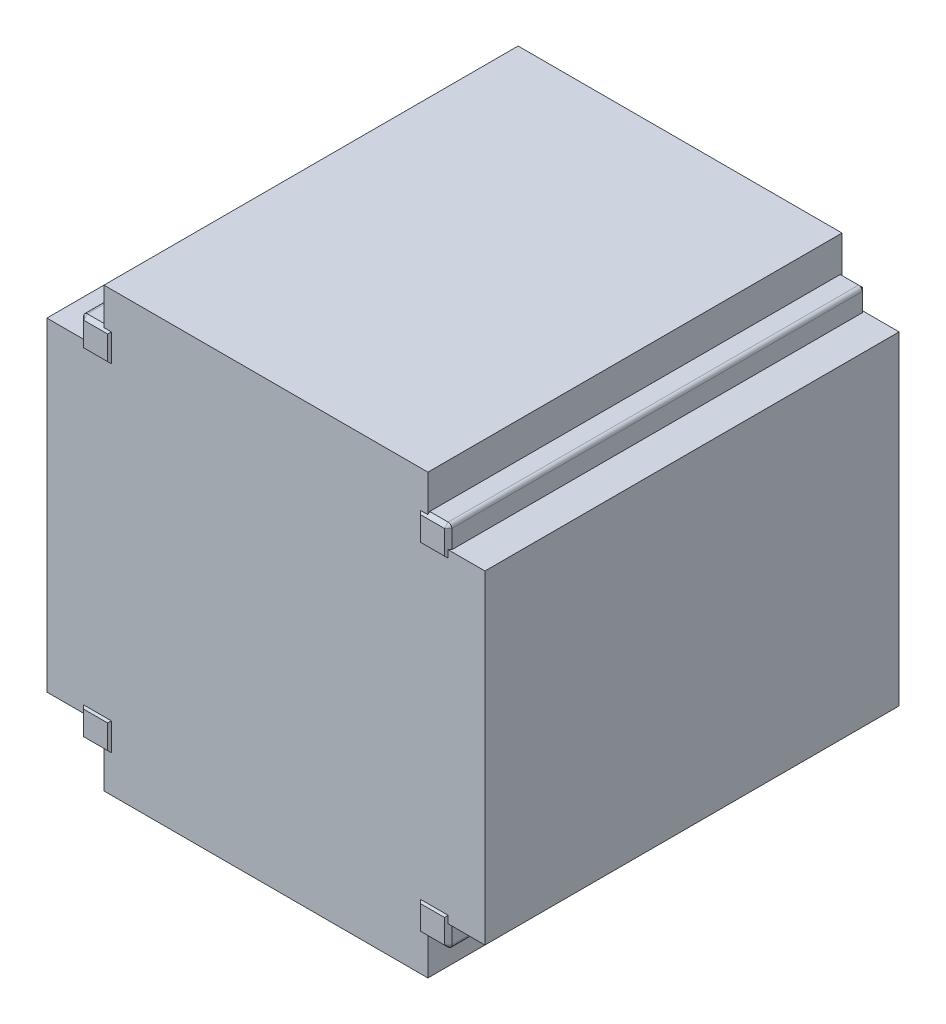
from build123d import *

# Parameters (mm, degrees)
BOSS_EXTRUDE1_DEPTH        = 56.75
BOSS_EXTRUDE1_DEPTH_BACK   = 56.75
SKETCH1_W                  = 8.5
SKETCH1_H                  = 8.5
BOSS_EXTRUDE1_2_DEPTH      = 56.75
BOSS_EXTRUDE1_2_DEPTH_BACK = 56.75
BOSS_EXTRUDE1_3_DEPTH      = 56.75
BOSS_EXTRUDE1_3_DEPTH_BACK = 56.75
BOSS_EXTRUDE1_4_DEPTH      = 56.75
BOSS_EXTRUDE1_4_DEPTH_BACK = 56.75
BOSS_EXTRUDE2_DEPTH        = 56.25
BOSS_EXTRUDE2_DEPTH_BACK   = 56.25
FILLET1_R                  = 1
CHAMFER2_SIZE              = 1


with BuildPart() as part:
    # Sketch1 → Boss-Extrude1 (new, two sides: drawn at the far end of the back side and taken through both)
    with BuildSketch(Plane.XY.offset(-BOSS_EXTRUDE1_DEPTH_BACK)):
        with Locations((-45.75, 45.75)):
            Rectangle(SKETCH1_W, SKETCH1_H)
    extrude(amount=BOSS_EXTRUDE1_DEPTH + BOSS_EXTRUDE1_DEPTH_BACK)



with BuildPart() as body_2:
    # Sketch1 → Boss-Extrude1 2 (new, two sides: drawn at the far end of the back side and taken through both)
    with BuildSketch(Plane.XY.offset(-BOSS_EXTRUDE1_2_DEPTH_BACK)):
        with Locations((45.75, 45.75)):
            Rectangle(SKETCH1_W, SKETCH1_H)
    extrude(amount=BOSS_EXTRUDE1_2_DEPTH + BOSS_EXTRUDE1_2_DEPTH_BACK)


with BuildPart() as body_3:
    # Sketch1 → Boss-Extrude1 3 (new, two sides: drawn at the far end of the back side and taken through both)
    with BuildSketch(Plane.XY.offset(-BOSS_EXTRUDE1_3_DEPTH_BACK)):
        with Locations((45.75, -45.75)):
            Rectangle(SKETCH1_W, SKETCH1_H)
    extrude(amount=BOSS_EXTRUDE1_3_DEPTH + BOSS_EXTRUDE1_3_DEPTH_BACK)


with BuildPart() as body_4:
    # Sketch1 → Boss-Extrude1 4 (new, two sides: drawn at the far end of the back side and taken through both)
    with BuildSketch(Plane.XY.offset(-BOSS_EXTRUDE1_4_DEPTH_BACK)):
        with Locations((-45.75, -45.75)):
            Rectangle(SKETCH1_W, SKETCH1_H)
    extrude(amount=BOSS_EXTRUDE1_4_DEPTH + BOSS_EXTRUDE1_4_DEPTH_BACK)


with BuildPart() as part_1:
    add(part.part)

    add(body_2.part)  # Boss-Extrude2 merges body 2

    add(body_3.part)  # Boss-Extrude2 merges body 3

    add(body_4.part)  # Boss-Extrude2 merges body 4
    # Sketch2 → Boss-Extrude2 (add, two sides: drawn at the far end of the back side and taken through both)
    with BuildSketch(Plane.XY.offset(-BOSS_EXTRUDE2_DEPTH_BACK)):
        Polygon((-44, 50), (-44, 59.5), (44, 59.5), (44, 50), (50, 50), (50, 44), (59.5, 44), (59.5, -44), (50, -44), (50, -50), (44, -50), (44, -59.5), (-44, -59.5), (-44, -50), (-50, -50), (-50, -44), (-59.5, -44), (-59.5, 44), (-50, 44), (-50, 50), align=None)
    extrude(amount=BOSS_EXTRUDE2_DEPTH + BOSS_EXTRUDE2_DEPTH_BACK)

    # Fillet1
    fillet1_edges = [part_1.edges().sort_by_distance(p)[0] for p in [
        (50, -50, 0),
        (-50, -50, 0),
        (-50, 50, 0),
        (50, 50, 0),
    ]]
    fillet(fillet1_edges, radius=FILLET1_R)

    # Chamfer2
    chamfer2_edges = [part_1.edges().sort_by_distance(p)[0] for p in [
        (45.25, -50, 56.75),
        (50, -45.25, 56.75),
        (49.707106781, -49.707106781, 56.75),
    ]]
    chamfer(chamfer2_edges, length=CHAMFER2_SIZE)
    chamfer2_2_edges = [part_1.edges().sort_by_distance(p)[0] for p in [
        (45.25, -50, -56.75),
        (50, -45.25, -56.75),
        (49.707106781, -49.707106781, -56.75),
    ]]
    chamfer(chamfer2_2_edges, length=CHAMFER2_SIZE)
    chamfer2_3_edges = [part_1.edges().sort_by_distance(p)[0] for p in [
        (50, 45.25, 56.75),
        (45.25, 50, 56.75),
        (49.707106781, 49.707106781, 56.75),
    ]]
    chamfer(chamfer2_3_edges, length=CHAMFER2_SIZE)
    chamfer2_4_edges = [part_1.edges().sort_by_distance(p)[0] for p in [
        (50, 45.25, -56.75),
        (45.25, 50, -56.75),
        (49.707106781, 49.707106781, -56.75),
    ]]
    chamfer(chamfer2_4_edges, length=CHAMFER2_SIZE)
    chamfer2_5_edges = [part_1.edges().sort_by_distance(p)[0] for p in [
        (-45.25, 50, 56.75),
        (-49.707106781, 49.707106781, 56.75),
        (-50, 45.25, 56.75),
    ]]
    chamfer(chamfer2_5_edges, length=CHAMFER2_SIZE)
    chamfer2_6_edges = [part_1.edges().sort_by_distance(p)[0] for p in [
        (-45.25, 50, -56.75),
        (-49.707106781, 49.707106781, -56.75),
        (-50, 45.25, -56.75),
    ]]
    chamfer(chamfer2_6_edges, length=CHAMFER2_SIZE)
    chamfer2_7_edges = [part_1.edges().sort_by_distance(p)[0] for p in [
        (-50, -45.25, 56.75),
        (-45.25, -50, 56.75),
        (-49.707106781, -49.707106781, 56.75),
    ]]
    chamfer(chamfer2_7_edges, length=CHAMFER2_SIZE)
    chamfer2_8_edges = [part_1.edges().sort_by_distance(p)[0] for p in [
        (-50, -45.25, -56.75),
        (-45.25, -50, -56.75),
        (-49.707106781, -49.707106781, -56.75),
    ]]
    chamfer(chamfer2_8_edges, length=CHAMFER2_SIZE)
    # the kernel refuses this chamfer: 1 mm, written as the material it takes off along each edge
    with BuildSketch(Plane(origin=(41.5, -51.571682988, 56.75), x_dir=(-0.027495876610589005, 0, -0.9996219169112968), z_dir=(0, 1, 0))) as chamfer2_9_piece_1_section:
        with BuildLine():
            Line((1.028673195, 0), (-0.056547155, -1.027117794))
            Line((-0.056547155, -1.027117794), (-0.076539593, -1.026567876))
            ThreePointArc((-0.076539593, -1.026567876), (-0.034129227, -0.51339783), (-0.019992438, 0.000549918))
            Line((-0.019992438, 0.000549918), (0.000549918, 0.019992438))
            ThreePointArc((0.000549918, 0.019992438), (0.514497665, 0.00585565), (1.029223113, 0.019992438))
            Line((1.029223113, 0.019992438), (1.028673195, 0))
        make_face()
    chamfer2_9_piece_1 = extrude(amount=12.643365976, mode=Mode.PRIVATE)
    chamfer2_9_piece_1 = split(chamfer2_9_piece_1, bisect_by=Plane(origin=(41.893401084, -45.25, 56.25), z_dir=(0, 0, 1)), keep=Keep.TOP, mode=Mode.PRIVATE)
    add(chamfer2_9_piece_1, mode=Mode.SUBTRACT)
    # the kernel refuses this chamfer: 1 mm, written as the material it takes off along each edge
    with BuildSketch(Plane(origin=(41.5, -51.571682988, -56.75), x_dir=(-0.027495876610589005, 0, 0.9996219169112968), z_dir=(0, 1, 0))) as chamfer2_10_piece_1_section:
        with BuildLine():
            Line((1.028673195, 0), (-0.056547155, 1.027117794))
            Line((-0.056547155, 1.027117794), (-0.076539593, 1.026567876))
            ThreePointArc((-0.076539593, 1.026567876), (-0.034129227, 0.51339783), (-0.019992438, -0.000549918))
            Line((-0.019992438, -0.000549918), (0.000549918, -0.019992438))
            ThreePointArc((0.000549918, -0.019992438), (0.514497665, -0.00585565), (1.029223113, -0.019992438))
            Line((1.029223113, -0.019992438), (1.028673195, 0))
        make_face()
    chamfer2_10_piece_1 = extrude(amount=12.643365976, mode=Mode.PRIVATE)
    chamfer2_10_piece_1 = split(chamfer2_10_piece_1, bisect_by=Plane(origin=(41.893401084, -45.25, -56.25), z_dir=(0, 0, -1)), keep=Keep.TOP, mode=Mode.PRIVATE)
    add(chamfer2_10_piece_1, mode=Mode.SUBTRACT)
    # the kernel refuses this chamfer: 1 mm, written as the material it takes off along each edge
    with BuildSketch(Plane(origin=(39.928317012, -41.5, 56.75), x_dir=(0, 0.027495876610589005, -0.9996219169112968), z_dir=(1, 0, 0))) as chamfer2_11_piece_1_section:
        with BuildLine():
            Line((1.028673195, 0), (-0.056547155, -1.027117794))
            Line((-0.056547155, -1.027117794), (-0.076539593, -1.026567876))
            ThreePointArc((-0.076539593, -1.026567876), (-0.034129227, -0.51339783), (-0.019992438, 0.000549918))
            Line((-0.019992438, 0.000549918), (0.000549918, 0.019992438))
            ThreePointArc((0.000549918, 0.019992438), (0.514497665, 0.00585565), (1.029223113, 0.019992438))
            Line((1.029223113, 0.019992438), (1.028673195, 0))
        make_face()
    chamfer2_11_piece_1 = extrude(amount=11.643365976, mode=Mode.PRIVATE)
    chamfer2_11_piece_1 = split(chamfer2_11_piece_1, bisect_by=Plane(origin=(45.75, -41.893401084, 56.25), z_dir=(0, 0, 1)), keep=Keep.TOP, mode=Mode.PRIVATE)
    add(chamfer2_11_piece_1, mode=Mode.SUBTRACT)
    # the kernel refuses this chamfer: 1 mm, written as the material it takes off along each edge
    with BuildSketch(Plane(origin=(39.928317012, -41.5, -56.75), x_dir=(0, 0.027495876610589005, 0.9996219169112968), z_dir=(1, 0, 0))) as chamfer2_12_piece_1_section:
        with BuildLine():
            Line((1.028673195, 0), (-0.056547155, 1.027117794))
            Line((-0.056547155, 1.027117794), (-0.076539593, 1.026567876))
            ThreePointArc((-0.076539593, 1.026567876), (-0.034129227, 0.51339783), (-0.019992438, -0.000549918))
            Line((-0.019992438, -0.000549918), (0.000549918, -0.019992438))
            ThreePointArc((0.000549918, -0.019992438), (0.514497665, -0.00585565), (1.029223113, -0.019992438))
            Line((1.029223113, -0.019992438), (1.028673195, 0))
        make_face()
    chamfer2_12_piece_1 = extrude(amount=11.643365976, mode=Mode.PRIVATE)
    chamfer2_12_piece_1 = split(chamfer2_12_piece_1, bisect_by=Plane(origin=(45.75, -41.893401084, -56.25), z_dir=(0, 0, -1)), keep=Keep.TOP, mode=Mode.PRIVATE)
    add(chamfer2_12_piece_1, mode=Mode.SUBTRACT)
    # the kernel refuses this chamfer: 1 mm, written as the material it takes off along each edge
    with BuildSketch(Plane(origin=(38.928317012, 41.5, 56.75), x_dir=(0, -0.027495876610589005, -0.9996219169112968), z_dir=(1, 0, 0))) as chamfer2_13_piece_1_section:
        with BuildLine():
            Line((1.028673195, 0), (-0.056547155, 1.027117794))
            Line((-0.056547155, 1.027117794), (-0.076539593, 1.026567876))
            ThreePointArc((-0.076539593, 1.026567876), (-0.034129227, 0.51339783), (-0.019992438, -0.000549918))
            Line((-0.019992438, -0.000549918), (0.000549918, -0.019992438))
            ThreePointArc((0.000549918, -0.019992438), (0.514497665, -0.00585565), (1.029223113, -0.019992438))
            Line((1.029223113, -0.019992438), (1.028673195, 0))
        make_face()
    chamfer2_13_piece_1 = extrude(amount=12.643365976, mode=Mode.PRIVATE)
    chamfer2_13_piece_1 = split(chamfer2_13_piece_1, bisect_by=Plane(origin=(45.25, 41.893401084, 56.25), z_dir=(0, 0, 1)), keep=Keep.TOP, mode=Mode.PRIVATE)
    add(chamfer2_13_piece_1, mode=Mode.SUBTRACT)
    # the kernel refuses this chamfer: 1 mm, written as the material it takes off along each edge
    with BuildSketch(Plane(origin=(41.5, 51.571682988, 56.75), x_dir=(-0.027495876610589005, 0, -0.9996219169112968), z_dir=(0, -1, 0))) as chamfer2_14_piece_1_section:
        with BuildLine():
            Line((1.028673195, 0), (-0.056547155, 1.027117794))
            Line((-0.056547155, 1.027117794), (-0.076539593, 1.026567876))
            ThreePointArc((-0.076539593, 1.026567876), (-0.034129227, 0.51339783), (-0.019992438, -0.000549918))
            Line((-0.019992438, -0.000549918), (0.000549918, -0.019992438))
            ThreePointArc((0.000549918, -0.019992438), (0.514497665, -0.00585565), (1.029223113, -0.019992438))
            Line((1.029223113, -0.019992438), (1.028673195, 0))
        make_face()
    chamfer2_14_piece_1 = extrude(amount=11.643365976, mode=Mode.PRIVATE)
    chamfer2_14_piece_1 = split(chamfer2_14_piece_1, bisect_by=Plane(origin=(41.893401084, 45.75, 56.25), z_dir=(0, 0, 1)), keep=Keep.TOP, mode=Mode.PRIVATE)
    add(chamfer2_14_piece_1, mode=Mode.SUBTRACT)
    # the kernel refuses this chamfer: 1 mm, written as the material it takes off along each edge
    with BuildSketch(Plane(origin=(38.928317012, 41.5, -56.75), x_dir=(0, -0.027495876610589005, 0.9996219169112968), z_dir=(1, 0, 0))) as chamfer2_15_piece_1_section:
        with BuildLine():
            Line((1.028673195, 0), (-0.056547155, -1.027117794))
            Line((-0.056547155, -1.027117794), (-0.076539593, -1.026567876))
            ThreePointArc((-0.076539593, -1.026567876), (-0.034129227, -0.51339783), (-0.019992438, 0.000549918))
            Line((-0.019992438, 0.000549918), (0.000549918, 0.019992438))
            ThreePointArc((0.000549918, 0.019992438), (0.514497665, 0.00585565), (1.029223113, 0.019992438))
            Line((1.029223113, 0.019992438), (1.028673195, 0))
        make_face()
    chamfer2_15_piece_1 = extrude(amount=12.643365976, mode=Mode.PRIVATE)
    chamfer2_15_piece_1 = split(chamfer2_15_piece_1, bisect_by=Plane(origin=(45.25, 41.893401084, -56.25), z_dir=(0, 0, -1)), keep=Keep.TOP, mode=Mode.PRIVATE)
    add(chamfer2_15_piece_1, mode=Mode.SUBTRACT)
    # the kernel refuses this chamfer: 1 mm, written as the material it takes off along each edge
    with BuildSketch(Plane(origin=(41.5, 51.571682988, -56.75), x_dir=(-0.027495876610589005, 0, 0.9996219169112968), z_dir=(0, -1, 0))) as chamfer2_16_piece_1_section:
        with BuildLine():
            Line((1.028673195, 0), (-0.056547155, -1.027117794))
            Line((-0.056547155, -1.027117794), (-0.076539593, -1.026567876))
            ThreePointArc((-0.076539593, -1.026567876), (-0.034129227, -0.51339783), (-0.019992438, 0.000549918))
            Line((-0.019992438, 0.000549918), (0.000549918, 0.019992438))
            ThreePointArc((0.000549918, 0.019992438), (0.514497665, 0.00585565), (1.029223113, 0.019992438))
            Line((1.029223113, 0.019992438), (1.028673195, 0))
        make_face()
    chamfer2_16_piece_1 = extrude(amount=11.643365976, mode=Mode.PRIVATE)
    chamfer2_16_piece_1 = split(chamfer2_16_piece_1, bisect_by=Plane(origin=(41.893401084, 45.75, -56.25), z_dir=(0, 0, -1)), keep=Keep.TOP, mode=Mode.PRIVATE)
    add(chamfer2_16_piece_1, mode=Mode.SUBTRACT)
    # the kernel refuses this chamfer: 1 mm, written as the material it takes off along each edge
    with BuildSketch(Plane(origin=(-41.5, 51.571682988, 56.75), x_dir=(0.027495876610589005, 0, -0.9996219169112968), z_dir=(0, -1, 0))) as chamfer2_17_piece_1_section:
        with BuildLine():
            Line((1.028673195, 0), (-0.056547155, -1.027117794))
            Line((-0.056547155, -1.027117794), (-0.076539593, -1.026567876))
            ThreePointArc((-0.076539593, -1.026567876), (-0.034129227, -0.51339783), (-0.019992438, 0.000549918))
            Line((-0.019992438, 0.000549918), (0.000549918, 0.019992438))
            ThreePointArc((0.000549918, 0.019992438), (0.514497665, 0.00585565), (1.029223113, 0.019992438))
            Line((1.029223113, 0.019992438), (1.028673195, 0))
        make_face()
    chamfer2_17_piece_1 = extrude(amount=12.643365976, mode=Mode.PRIVATE)
    chamfer2_17_piece_1 = split(chamfer2_17_piece_1, bisect_by=Plane(origin=(-41.893401084, 45.25, 56.25), z_dir=(0, 0, 1)), keep=Keep.TOP, mode=Mode.PRIVATE)
    add(chamfer2_17_piece_1, mode=Mode.SUBTRACT)
    # the kernel refuses this chamfer: 1 mm, written as the material it takes off along each edge
    with BuildSketch(Plane(origin=(-39.928317012, 41.5, 56.75), x_dir=(0, -0.027495876610589005, -0.9996219169112968), z_dir=(-1, 0, 0))) as chamfer2_18_piece_1_section:
        with BuildLine():
            Line((1.028673195, 0), (-0.056547155, -1.027117794))
            Line((-0.056547155, -1.027117794), (-0.076539593, -1.026567876))
            ThreePointArc((-0.076539593, -1.026567876), (-0.034129227, -0.51339783), (-0.019992438, 0.000549918))
            Line((-0.019992438, 0.000549918), (0.000549918, 0.019992438))
            ThreePointArc((0.000549918, 0.019992438), (0.514497665, 0.00585565), (1.029223113, 0.019992438))
            Line((1.029223113, 0.019992438), (1.028673195, 0))
        make_face()
    chamfer2_18_piece_1 = extrude(amount=11.643365976, mode=Mode.PRIVATE)
    chamfer2_18_piece_1 = split(chamfer2_18_piece_1, bisect_by=Plane(origin=(-45.75, 41.893401084, 56.25), z_dir=(0, 0, 1)), keep=Keep.TOP, mode=Mode.PRIVATE)
    add(chamfer2_18_piece_1, mode=Mode.SUBTRACT)
    # the kernel refuses this chamfer: 1 mm, written as the material it takes off along each edge
    with BuildSketch(Plane(origin=(-41.5, 51.571682988, -56.75), x_dir=(0.027495876610589005, 0, 0.9996219169112968), z_dir=(0, -1, 0))) as chamfer2_19_piece_1_section:
        with BuildLine():
            Line((1.028673195, 0), (-0.056547155, 1.027117794))
            Line((-0.056547155, 1.027117794), (-0.076539593, 1.026567876))
            ThreePointArc((-0.076539593, 1.026567876), (-0.034129227, 0.51339783), (-0.019992438, -0.000549918))
            Line((-0.019992438, -0.000549918), (0.000549918, -0.019992438))
            ThreePointArc((0.000549918, -0.019992438), (0.514497665, -0.00585565), (1.029223113, -0.019992438))
            Line((1.029223113, -0.019992438), (1.028673195, 0))
        make_face()
    chamfer2_19_piece_1 = extrude(amount=12.643365976, mode=Mode.PRIVATE)
    chamfer2_19_piece_1 = split(chamfer2_19_piece_1, bisect_by=Plane(origin=(-41.893401084, 45.25, -56.25), z_dir=(0, 0, -1)), keep=Keep.TOP, mode=Mode.PRIVATE)
    add(chamfer2_19_piece_1, mode=Mode.SUBTRACT)
    # the kernel refuses this chamfer: 1 mm, written as the material it takes off along each edge
    with BuildSketch(Plane(origin=(-39.928317012, 41.5, -56.75), x_dir=(0, -0.027495876610589005, 0.9996219169112968), z_dir=(-1, 0, 0))) as chamfer2_20_piece_1_section:
        with BuildLine():
            Line((1.028673195, 0), (-0.056547155, 1.027117794))
            Line((-0.056547155, 1.027117794), (-0.076539593, 1.026567876))
            ThreePointArc((-0.076539593, 1.026567876), (-0.034129227, 0.51339783), (-0.019992438, -0.000549918))
            Line((-0.019992438, -0.000549918), (0.000549918, -0.019992438))
            ThreePointArc((0.000549918, -0.019992438), (0.514497665, -0.00585565), (1.029223113, -0.019992438))
            Line((1.029223113, -0.019992438), (1.028673195, 0))
        make_face()
    chamfer2_20_piece_1 = extrude(amount=11.643365976, mode=Mode.PRIVATE)
    chamfer2_20_piece_1 = split(chamfer2_20_piece_1, bisect_by=Plane(origin=(-45.75, 41.893401084, -56.25), z_dir=(0, 0, -1)), keep=Keep.TOP, mode=Mode.PRIVATE)
    add(chamfer2_20_piece_1, mode=Mode.SUBTRACT)
    # the kernel refuses this chamfer: 1 mm, written as the material it takes off along each edge
    with BuildSketch(Plane(origin=(-38.928317012, -41.5, 56.75), x_dir=(0, 0.027495876610589005, -0.9996219169112968), z_dir=(-1, 0, 0))) as chamfer2_21_piece_1_section:
        with BuildLine():
            Line((1.028673195, 0), (-0.056547155, 1.027117794))
            Line((-0.056547155, 1.027117794), (-0.076539593, 1.026567876))
            ThreePointArc((-0.076539593, 1.026567876), (-0.034129227, 0.51339783), (-0.019992438, -0.000549918))
            Line((-0.019992438, -0.000549918), (0.000549918, -0.019992438))
            ThreePointArc((0.000549918, -0.019992438), (0.514497665, -0.00585565), (1.029223113, -0.019992438))
            Line((1.029223113, -0.019992438), (1.028673195, 0))
        make_face()
    chamfer2_21_piece_1 = extrude(amount=12.643365976, mode=Mode.PRIVATE)
    chamfer2_21_piece_1 = split(chamfer2_21_piece_1, bisect_by=Plane(origin=(-45.25, -41.893401084, 56.25), z_dir=(0, 0, 1)), keep=Keep.TOP, mode=Mode.PRIVATE)
    add(chamfer2_21_piece_1, mode=Mode.SUBTRACT)
    # the kernel refuses this chamfer: 1 mm, written as the material it takes off along each edge
    with BuildSketch(Plane(origin=(-41.5, -51.571682988, 56.75), x_dir=(-0.9996219169112968, 0, 0.027495876610589005), z_dir=(0, 1, 0))) as chamfer2_22_piece_1_section:
        with BuildLine():
            Line((1.028673195, 0), (-0.056547155, -1.027117794))
            Line((-0.056547155, -1.027117794), (-0.076539593, -1.026567876))
            ThreePointArc((-0.076539593, -1.026567876), (-0.034129227, -0.51339783), (-0.019992438, 0.000549918))
            Line((-0.019992438, 0.000549918), (0.000549918, 0.019992438))
            ThreePointArc((0.000549918, 0.019992438), (0.514497665, 0.00585565), (1.029223113, 0.019992438))
            Line((1.029223113, 0.019992438), (1.028673195, 0))
        make_face()
    chamfer2_22_piece_1 = extrude(amount=11.643365976, mode=Mode.PRIVATE)
    chamfer2_22_piece_1 = split(chamfer2_22_piece_1, bisect_by=Plane(origin=(-41.893401084, -45.75, 56.25), z_dir=(0, 0, 1)), keep=Keep.TOP, mode=Mode.PRIVATE)
    add(chamfer2_22_piece_1, mode=Mode.SUBTRACT)
    # the kernel refuses this chamfer: 1 mm, written as the material it takes off along each edge
    with BuildSketch(Plane(origin=(-38.928317012, -41.5, -56.75), x_dir=(0, 0.027495876610589005, 0.9996219169112968), z_dir=(-1, 0, 0))) as chamfer2_23_piece_1_section:
        with BuildLine():
            Line((1.028673195, 0), (-0.056547155, -1.027117794))
            Line((-0.056547155, -1.027117794), (-0.076539593, -1.026567876))
            ThreePointArc((-0.076539593, -1.026567876), (-0.034129227, -0.51339783), (-0.019992438, 0.000549918))
            Line((-0.019992438, 0.000549918), (0.000549918, 0.019992438))
            ThreePointArc((0.000549918, 0.019992438), (0.514497665, 0.00585565), (1.029223113, 0.019992438))
            Line((1.029223113, 0.019992438), (1.028673195, 0))
        make_face()
    chamfer2_23_piece_1 = extrude(amount=12.643365976, mode=Mode.PRIVATE)
    chamfer2_23_piece_1 = split(chamfer2_23_piece_1, bisect_by=Plane(origin=(-45.25, -41.893401084, -56.25), z_dir=(0, 0, -1)), keep=Keep.TOP, mode=Mode.PRIVATE)
    add(chamfer2_23_piece_1, mode=Mode.SUBTRACT)
    # the kernel refuses this chamfer: 1 mm, written as the material it takes off along each edge
    with BuildSketch(Plane(origin=(-41.5, -51.571682988, -56.75), x_dir=(-0.9996219169112968, 0, -0.027495876610589005), z_dir=(0, 1, 0))) as chamfer2_24_piece_1_section:
        with BuildLine():
            Line((1.028673195, 0), (-0.056547155, 1.027117794))
            Line((-0.056547155, 1.027117794), (-0.076539593, 1.026567876))
            ThreePointArc((-0.076539593, 1.026567876), (-0.034129227, 0.51339783), (-0.019992438, -0.000549918))
            Line((-0.019992438, -0.000549918), (0.000549918, -0.019992438))
            ThreePointArc((0.000549918, -0.019992438), (0.514497665, -0.00585565), (1.029223113, -0.019992438))
            Line((1.029223113, -0.019992438), (1.028673195, 0))
        make_face()
    chamfer2_24_piece_1 = extrude(amount=11.643365976, mode=Mode.PRIVATE)
    chamfer2_24_piece_1 = split(chamfer2_24_piece_1, bisect_by=Plane(origin=(-41.893401084, -45.75, -56.25), z_dir=(0, 0, -1)), keep=Keep.TOP, mode=Mode.PRIVATE)
    add(chamfer2_24_piece_1, mode=Mode.SUBTRACT)


solid = part_1.part
